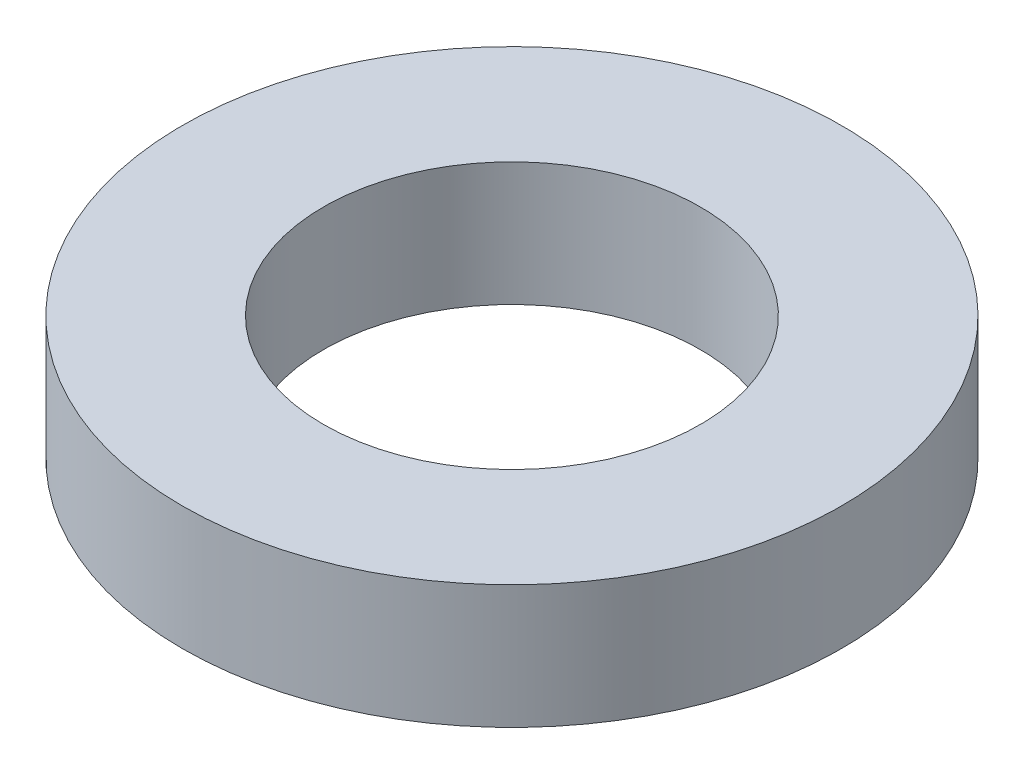
from build123d import *

# Parameters (mm, degrees)
SKETCH1_R           = 5.334
SKETCH1_R_2         = 3.05
BOSS_EXTRUDE1_DEPTH = 2


with BuildPart() as part:
    # Sketch1 → Boss-Extrude1 (new body)
    with BuildSketch(Plane(origin=(0, 0, 0), x_dir=(1, 0, 0), z_dir=(0, 1, 0))):
        Circle(SKETCH1_R)
        Circle(SKETCH1_R_2, mode=Mode.SUBTRACT)
    extrude(amount=BOSS_EXTRUDE1_DEPTH)


solid = part.part
